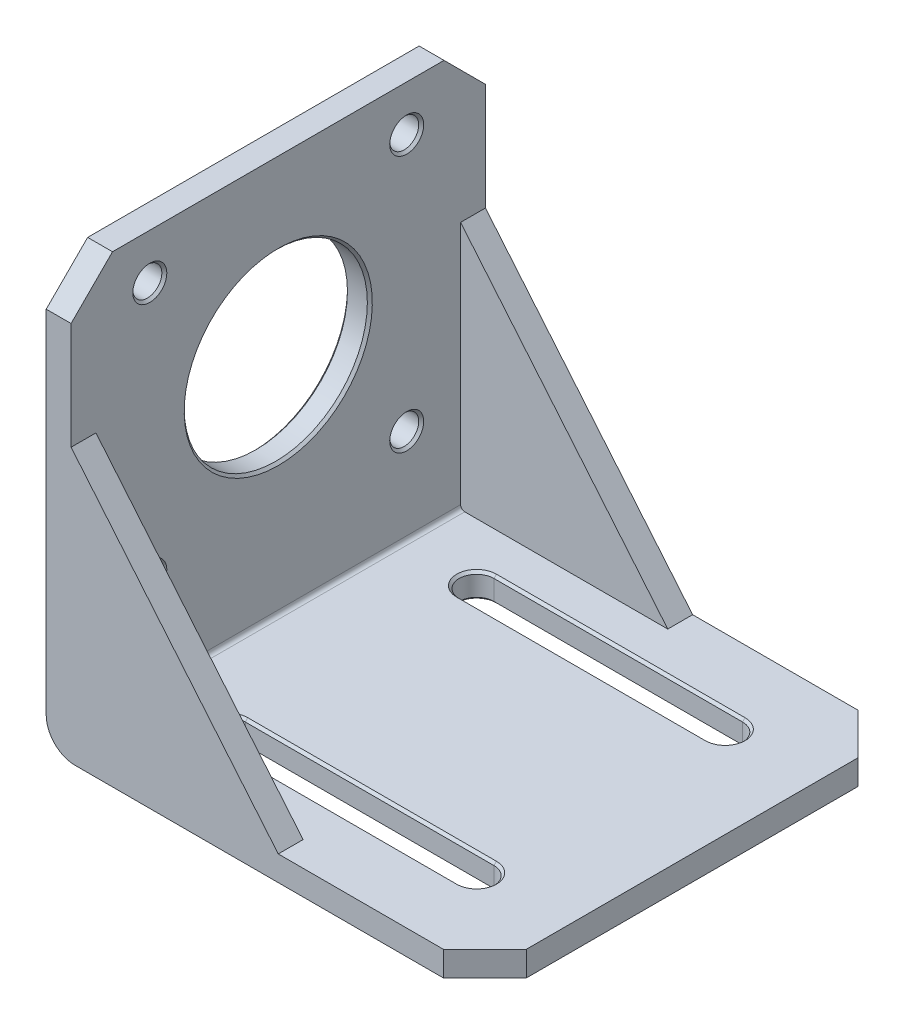
from build123d import *

# Parameters (mm, degrees)
SKETCH1_W                    = 100
SKETCH1_H                    = 50
BASE_FLANGE1_DEPTH           = 3
SKETCH2_R                    = 11.05
SKETCH2_R_2                  = 1.75
CUT_EXTRUDE1_DEPTH           = 104.121287812
CUT_EXTRUDE3_DEPTH           = 104.121287812
SKETCHED_BEND2_OUTLINE_W     = 3
SKETCHED_BEND2_OUTLINE_H     = 50
SKETCHED_BEND2_DEPTH         = 47.070796327
SKETCHED_START               = 47.411206327
SKETCHED_BEND2_2_OUTLINE_W   = 47.929203673
SKETCHED_BEND2_2_OUTLINE_H   = 50
SKETCHED_BEND2_2_OUTLINE_R   = 1.75
SKETCHED_BEND2_2_OUTLINE_R_2 = 11.05
SKETCHED_BEND2_2_DEPTH       = 2.65959
SKETCHED_START_2             = 47.070796327
SKETCHED_BEND2_3_OUTLINE_W   = 47.929203673
SKETCHED_BEND2_3_OUTLINE_H   = 50
SKETCHED_BEND2_3_OUTLINE_R   = 1.75
SKETCHED_BEND2_3_OUTLINE_R_2 = 11.05
SKETCHED_BEND2_3_DEPTH       = 3.5
SKETCHED_START_3             = -26
SKETCHED_BEND2_4_DEPTH       = 52
BOSS_EXTRUDE1_DEPTH          = 3
CHAMFER1_SIZE                = 5
CHAMFER2_SIZE                = 0.3


with BuildPart() as part:
    # Base-Flange1: sheet metal written as solids
    # Sketch1 → Base-Flange1 (new body)
    with BuildSketch(Plane(origin=(0, 0, 0), x_dir=(1, 0, 0), z_dir=(0, 1, 0))):
        with Locations((50, 0)):
            Rectangle(SKETCH1_W, SKETCH1_H)
    extrude(amount=-BASE_FLANGE1_DEPTH)

    # Sketch2 → Cut-Extrude1 (cut, through all)
    with BuildSketch(Plane(origin=(0, 0, 0), x_dir=(1, 0, 0), z_dir=(0, 1, 0))):
        with Locations(Location((21, 0, 0), (0, 0, 270))):
            Circle(SKETCH2_R)
        with Locations(Location((5.5, 15.5, 0), (0, 0, 270))):
            Circle(SKETCH2_R_2)
        with Locations(Location((36.5, 15.5, 0), (0, 0, 270))):
            Circle(SKETCH2_R_2)
        with Locations(Location((36.5, -15.5, 0), (0, 0, 270))):
            Circle(SKETCH2_R_2)
        with Locations(Location((5.5, -15.5, 0), (0, 0, 270))):
            Circle(SKETCH2_R_2)
    extrude(amount=-CUT_EXTRUDE1_DEPTH, mode=Mode.SUBTRACT)

    # Sketch4 → Cut-Extrude3 (cut, through all)
    with BuildSketch(Plane(origin=(0, 0, 0), x_dir=(1, 0, 0), z_dir=(0, 1, 0))):
        with BuildLine():
            Line((59, 17.1), (89, 17.1))
            ThreePointArc((89, 17.1), (91.1, 15), (89, 12.9))
            Line((89, 12.9), (59, 12.9))
            ThreePointArc((59, 12.9), (56.9, 15), (59, 17.1))
        make_face()
        with BuildLine():
            Line((59, -12.9), (89, -12.9))
            ThreePointArc((89, -12.9), (91.1, -15), (89, -17.1))
            Line((89, -17.1), (59, -17.1))
            ThreePointArc((59, -17.1), (56.9, -15), (59, -12.9))
        make_face()
    extrude(amount=-CUT_EXTRUDE3_DEPTH, mode=Mode.SUBTRACT)

    # Sketched Bend2: read off the stored shape, not the designer's step
    # Sketched Bend2 outline → Sketched Bend2 (cut)
    with BuildSketch(Plane.YZ):
        with Locations((-1.5, 0)):
            Rectangle(SKETCHED_BEND2_OUTLINE_W, SKETCHED_BEND2_OUTLINE_H)
    extrude(amount=SKETCHED_BEND2_DEPTH, mode=Mode.SUBTRACT)

    # Sketched Bend2 2 outline → Sketched Bend2 2 (add)
    with BuildSketch(Plane.YZ.offset(SKETCHED_START)):
        with Locations((23.964601837, 0)):
            Rectangle(SKETCHED_BEND2_2_OUTLINE_W, SKETCHED_BEND2_2_OUTLINE_H)
        with Locations((11.429203673, -15.5)):
            Circle(SKETCHED_BEND2_2_OUTLINE_R, mode=Mode.SUBTRACT)
        with Locations((42.429203673, -15.5)):
            Circle(SKETCHED_BEND2_2_OUTLINE_R, mode=Mode.SUBTRACT)
        with Locations((11.429203673, 15.5)):
            Circle(SKETCHED_BEND2_2_OUTLINE_R, mode=Mode.SUBTRACT)
        with Locations((26.929203673, 0)):
            Circle(SKETCHED_BEND2_2_OUTLINE_R_2, mode=Mode.SUBTRACT)
        with Locations((42.429203673, 15.5)):
            Circle(SKETCHED_BEND2_2_OUTLINE_R, mode=Mode.SUBTRACT)
    extrude(amount=SKETCHED_BEND2_2_DEPTH)

    # Sketched Bend2 3 outline → Sketched Bend2 3 (add)
    with BuildSketch(Plane.YZ.offset(SKETCHED_START_2)):
        with Locations((23.964601837, 0)):
            Rectangle(SKETCHED_BEND2_3_OUTLINE_W, SKETCHED_BEND2_3_OUTLINE_H)
        with Locations((11.429203673, -15.5)):
            Circle(SKETCHED_BEND2_3_OUTLINE_R, mode=Mode.SUBTRACT)
        with Locations((42.429203673, -15.5)):
            Circle(SKETCHED_BEND2_3_OUTLINE_R, mode=Mode.SUBTRACT)
        with Locations((11.429203673, 15.5)):
            Circle(SKETCHED_BEND2_3_OUTLINE_R, mode=Mode.SUBTRACT)
        with Locations((26.929203673, 0)):
            Circle(SKETCHED_BEND2_3_OUTLINE_R_2, mode=Mode.SUBTRACT)
        with Locations((42.429203673, 15.5)):
            Circle(SKETCHED_BEND2_3_OUTLINE_R, mode=Mode.SUBTRACT)
    extrude(amount=SKETCHED_BEND2_3_DEPTH)

    # Sketched Bend2 4 outline → Sketched Bend2 4 (cut)
    with BuildSketch(Plane.XY.offset(SKETCHED_START_3)):
        with BuildLine():
            Line((50.570796327, 47.929203673), (50.070796327, 47.929203673))
            Line((50.070796327, 47.929203673), (50.070796327, 0.5))
            ThreePointArc((50.070796327, 0.5), (50.217242936, 0.146446609), (50.570796327, 0))
            Line((50.570796327, 0), (50.570796327, 47.929203673))
        make_face()
        with BuildLine():
            ThreePointArc((50.570796327, -3), (48.095922593, -1.974873734), (47.070796327, 0.5))
            Line((47.070796327, 0.5), (47.070796327, -3))
            Line((47.070796327, -3), (50.570796327, -3))
        make_face()
    extrude(amount=SKETCHED_BEND2_4_DEPTH, mode=Mode.SUBTRACT)

    # Sketch6 → Boss-Extrude1 (add)
    with BuildSketch(Plane.XY.offset(25)):
        Polygon((50.070796327, 30), (75.070796327, 0), (50.070796327, 0), align=None)
    boss_extrude1 = extrude(amount=-BOSS_EXTRUDE1_DEPTH)

    # Mirror1: Boss-Extrude1 across plane
    add(boss_extrude1.mirror(Plane.XY))

    # Chamfer1
    chamfer1_edges = [part.edges().sort_by_distance(p)[0] for p in [
        (48.570796327, 47.929203673, -25),
        (48.570796327, 47.929203673, 25),
        (100, -1.5, -25),
        (100, -1.5, 25),
    ]]
    chamfer(chamfer1_edges, length=CHAMFER1_SIZE)

    # Chamfer2
    chamfer2_edges = [part.edges().sort_by_distance(p)[0] for p in [
        (47.070796327, 15.879203673, 0),
        (50.070796327, 15.879203673, 0),
        (47.070796327, 40.679203673, -15.5),
        (50.070796327, 40.679203673, -15.5),
        (47.070796327, 9.679203673, -15.5),
        (50.070796327, 9.679203673, -15.5),
        (47.070796327, 9.679203673, 15.5),
        (50.070796327, 9.679203673, 15.5),
        (47.070796327, 40.679203673, 15.5),
        (50.070796327, 40.679203673, 15.5),
        (74, 0, -17.1),
        (91.1, 0, -15),
        (74, 0, -12.9),
        (56.9, 0, -15),
        (74, 0, 12.9),
        (91.1, 0, 15),
        (74, 0, 17.1),
        (56.9, 0, 15),
        (56.9, -3, 15),
        (74, -3, 17.1),
        (91.1, -3, 15),
        (74, -3, 12.9),
        (56.9, -3, -15),
        (74, -3, -12.9),
        (91.1, -3, -15),
        (74, -3, -17.1),
    ]]
    chamfer(chamfer2_edges, length=CHAMFER2_SIZE)


solid = part.part
